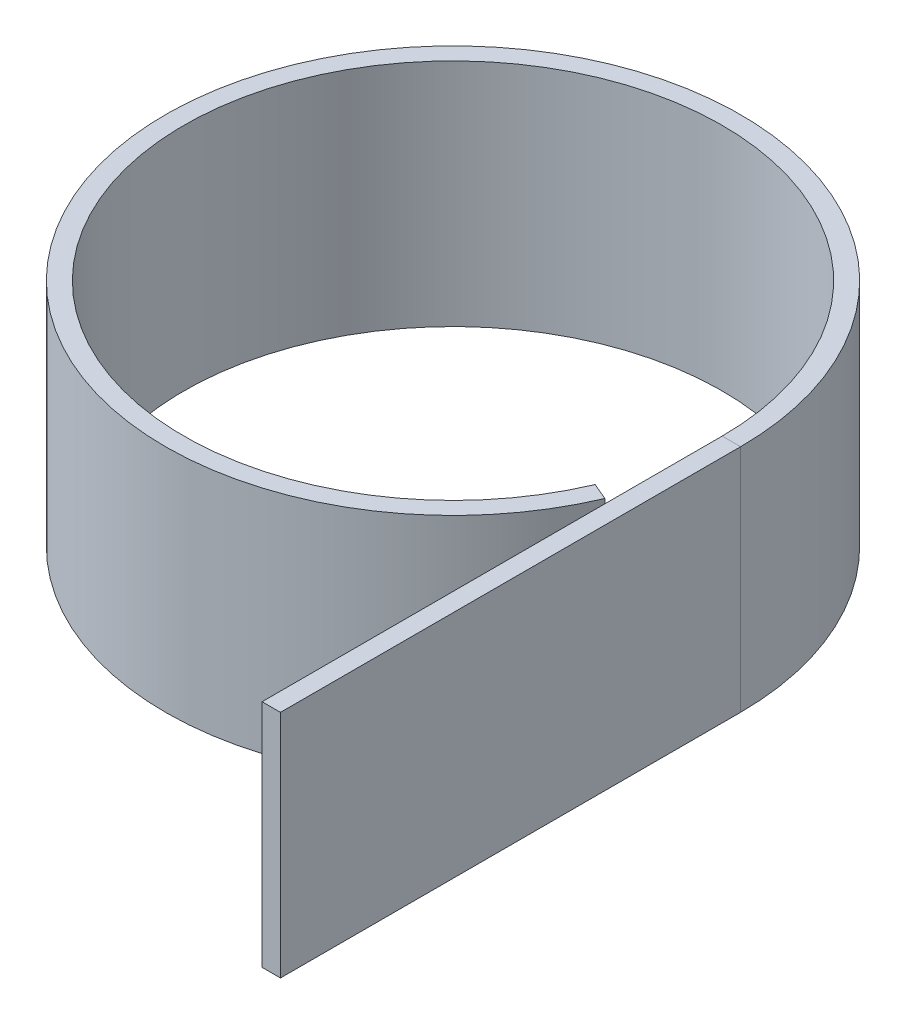
from build123d import *

# Parameters (mm, degrees)
BASE_FLANGE1_DEPTH = 10


# Sheet-metal steps are written as plain solids
with BuildPart() as part:
    # Sketch2 → Base-Flange1 (new body)
    with BuildSketch(Plane(origin=(0, 0, 0), x_dir=(1, 0, 0), z_dir=(0, 1, 0))):
        with BuildLine():
            ThreePointArc((11.5, -4.898979486), (-12.247448714, 2.5), (12.5, 0))
            Line((12.5, 0), (12.5, -20))
            Line((12.5, -20), (11.7, -20))
            Line((11.7, -20), (11.7, 0))
            ThreePointArc((11.7, 0), (-11.463611996, 2.34), (10.764, -4.585444798))
            Line((10.764, -4.585444798), (11.5, -4.898979486))
        make_face()
    extrude(amount=BASE_FLANGE1_DEPTH)


solid = part.part
